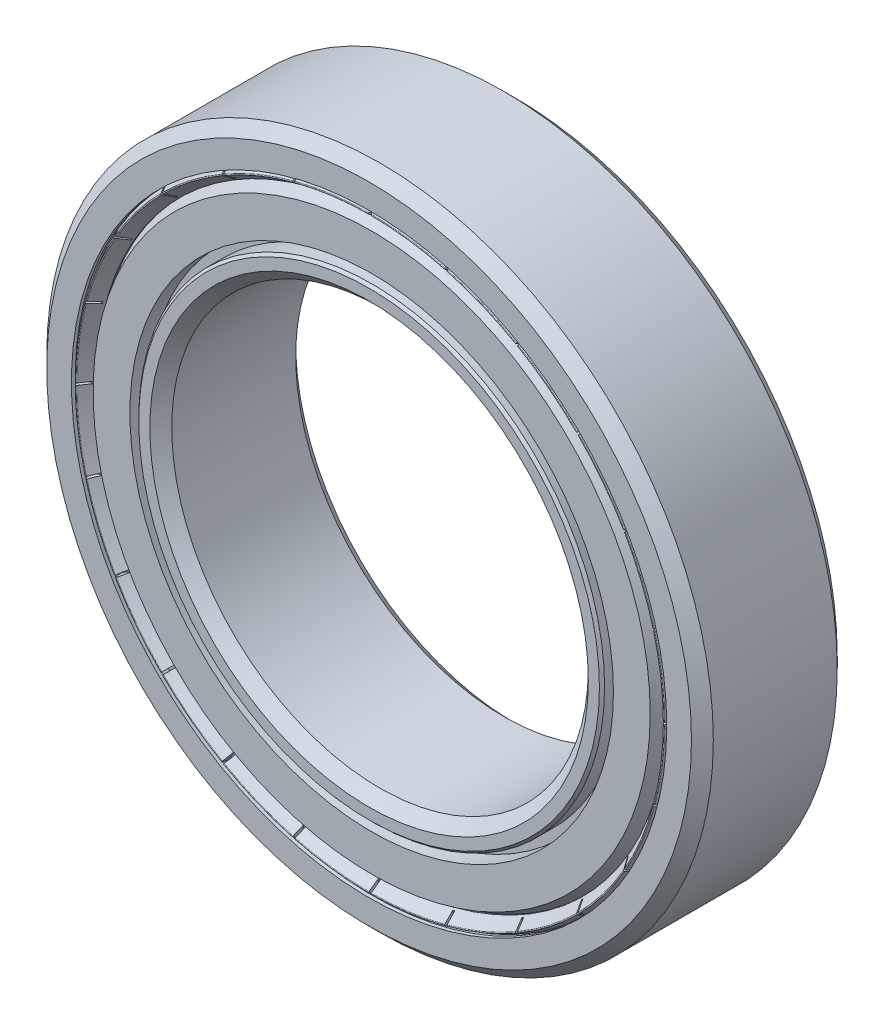
from build123d import *

# Parameters (mm, degrees)
CIRPATTERN1_COUNT  = 12
FILLET1_R          = 0.035
CUT_EXTRUDE1_START = 2.995758
CUT_EXTRUDE1_DEPTH = 20.900748284
CIRPATTERN2_COUNT  = 24


with BuildPart() as part:
    # Sketch3 → Revolve1 (revolve)
    with BuildSketch(Plane(origin=(0, 0, 0), x_dir=(0, 0, -1), z_dir=(1, 0, 0)), mode=Mode.PRIVATE) as revolve1_sk:
        with BuildLine():
            Line((2.975, 16), (-2.975, 16))
            Line((-2.975, 16), (-3.5, 15.475))
            Line((-3.5, 15.475), (-3.5, 14.289819322))
            Line((-3.5, 14.289819322), (-3.325, 14.289819322))
            Line((-3.325, 14.289819322), (-3.325, 14.694909661))
            Line((-3.325, 14.694909661), (-3.201256313, 14.818653348))
            Line((-3.201256313, 14.818653348), (-1.05, 14.818653348))
            ThreePointArc((-1.05, 14.818653348), (0, 15.1), (1.05, 14.818653348))
            Line((1.05, 14.818653348), (3.201256313, 14.818653348))
            Line((3.201256313, 14.818653348), (3.325, 14.694909661))
            Line((3.325, 14.694909661), (3.325, 14.289819322))
            Line((3.325, 14.289819322), (3.5, 14.289819322))
            Line((3.5, 14.289819322), (3.5, 15.475))
            Line((3.5, 15.475), (2.975, 16))
        make_face()
        with BuildLine():
            Line((2.975, 10), (-2.975, 10))
            Line((-2.975, 10), (-3.5, 10.525))
            Line((-3.5, 10.525), (-3.5, 11.057602965))
            Line((-3.5, 11.057602965), (-3.376256313, 11.181346652))
            Line((-3.376256313, 11.181346652), (-1.05, 11.181346652))
            ThreePointArc((-1.05, 11.181346652), (0, 10.9), (1.05, 11.181346652))
            Line((1.05, 11.181346652), (3.376256313, 11.181346652))
            Line((3.376256313, 11.181346652), (3.5, 11.057602965))
            Line((3.5, 11.057602965), (3.5, 10.525))
            Line((3.5, 10.525), (2.975, 10))
        make_face()
    revolve(revolve1_sk.sketch.rotate(Axis((0, 0, 3.5), (0, 0, -1)), 90), axis=Axis((0, 0, 3.5), (0, 0, -1)))


with BuildPart() as body_2:
    # Sketch4 → Revolve2 (revolve)
    with BuildSketch(Plane(origin=(0, 0, 0), x_dir=(0, 0, -1), z_dir=(1, 0, 0))):
        with BuildLine():
            Line((0, 15.1), (0, 10.9))
            ThreePointArc((0, 10.9), (-2.1, 13), (0, 15.1))
        make_face()
    revolve(axis=Axis((0, 16, 0), (0, -1, 0)))


with BuildPart() as cirpattern1_1:
    # CirPattern1: pattern copy
    add(body_2.part.rotate(Axis((0, 0, 0), (0, 0, 1)), 1 * 360 / CIRPATTERN1_COUNT))


with BuildPart() as cirpattern1_2:
    # CirPattern1: pattern copy
    add(body_2.part.rotate(Axis((0, 0, 0), (0, 0, 1)), 2 * 360 / CIRPATTERN1_COUNT))


with BuildPart() as cirpattern1_3:
    # CirPattern1: pattern copy
    add(body_2.part.rotate(Axis((0, 0, 0), (0, 0, 1)), 3 * 360 / CIRPATTERN1_COUNT))


with BuildPart() as cirpattern1_4:
    # CirPattern1: pattern copy
    add(body_2.part.rotate(Axis((0, 0, 0), (0, 0, 1)), 4 * 360 / CIRPATTERN1_COUNT))


with BuildPart() as cirpattern1_5:
    # CirPattern1: pattern copy
    add(body_2.part.rotate(Axis((0, 0, 0), (0, 0, 1)), 5 * 360 / CIRPATTERN1_COUNT))


with BuildPart() as cirpattern1_6:
    # CirPattern1: pattern copy
    add(body_2.part.rotate(Axis((0, 0, 0), (0, 0, 1)), 6 * 360 / CIRPATTERN1_COUNT))


with BuildPart() as cirpattern1_7:
    # CirPattern1: pattern copy
    add(body_2.part.rotate(Axis((0, 0, 0), (0, 0, 1)), 7 * 360 / CIRPATTERN1_COUNT))


with BuildPart() as cirpattern1_8:
    # CirPattern1: pattern copy
    add(body_2.part.rotate(Axis((0, 0, 0), (0, 0, 1)), 8 * 360 / CIRPATTERN1_COUNT))


with BuildPart() as cirpattern1_9:
    # CirPattern1: pattern copy
    add(body_2.part.rotate(Axis((0, 0, 0), (0, 0, 1)), 9 * 360 / CIRPATTERN1_COUNT))


with BuildPart() as cirpattern1_10:
    # CirPattern1: pattern copy
    add(body_2.part.rotate(Axis((0, 0, 0), (0, 0, 1)), 10 * 360 / CIRPATTERN1_COUNT))


with BuildPart() as cirpattern1_11:
    # CirPattern1: pattern copy
    add(body_2.part.rotate(Axis((0, 0, 0), (0, 0, 1)), 11 * 360 / CIRPATTERN1_COUNT))


with BuildPart() as body_14:
    # Sketch5 → Revolve3 (revolve)
    with BuildSketch(Plane(origin=(0, 0, 0), x_dir=(0, 0, -1), z_dir=(1, 0, 0)), mode=Mode.PRIVATE) as revolve3_sk:
        Polygon((-2.1, 11.181346652), (-2.525418771, 11.181346652), (-2.525418771, 11.606765423), (-3.376256313, 11.606765423), (-3.376256313, 13.373169267), (-2.525418771, 13.864400551), (-2.1, 13.864400551), align=None)
        Polygon((2.525418771, 13.864400551), (2.1, 13.864400551), (2.1, 11.181346652), (2.525418771, 11.181346652), (2.525418771, 11.606765423), (3.376256313, 11.606765423), (3.376256313, 13.373169267), align=None)
    revolve(revolve3_sk.sketch.rotate(Axis((0, 0, 3.5), (0, 0, -1)), 90), axis=Axis((0, 0, 3.5), (0, 0, -1)))


with BuildPart() as body_15:
    # Sketch6 → Revolve4 (revolve)
    with BuildSketch(Plane(origin=(0, 0, 0), x_dir=(0, 0, -1), z_dir=(1, 0, 0)), mode=Mode.PRIVATE) as revolve4_sk:
        Polygon((-2.797765893, 14.289819322), (-3.19375, 14.289819322), (-3.5, 14.113005803), (-2.902765893, 13.694817979), (-2.867765893, 13.694817979), (-2.797765893, 13.707160867), align=None)
    revolve(revolve4_sk.sketch.rotate(Axis((0, 0, 3.5), (0, 0, -1)), 90), axis=Axis((0, 0, 3.5), (0, 0, -1)))

    # Fillet1
    fillet1_edges = [body_15.edges().sort_by_distance(p)[0] for p in [
        (-14.113005803, 0, 3.5),
    ]]
    fillet(fillet1_edges, radius=FILLET1_R)

    # Sketch7 → Cut-Extrude1 (cut, through all)
    with BuildSketch(Plane.XY.offset(CUT_EXTRUDE1_START)):
        Polygon((-0.05, 14.289819322), (-0.05, 14.389819322), (0.05, 14.389819322), (0.05, 14.289819322), (0.05, 13.694817979), (0.05, 13.594817979), (-0.05, 13.594817979), (-0.05, 13.694817979), align=None)
    cut_extrude1 = extrude(amount=CUT_EXTRUDE1_DEPTH, mode=Mode.SUBTRACT)

    # CirPattern2: Cut-Extrude1 ×24 about axis
    cirpattern2_axis = Axis((0, 0, 0), (0, 0, 1))
    for i in range(1, CIRPATTERN2_COUNT):
        add(cut_extrude1.rotate(cirpattern2_axis, i * 360 / CIRPATTERN2_COUNT), mode=Mode.SUBTRACT)


with BuildPart() as body_16:
    # Mirror1: mirrored copy
    add(body_15.part.mirror(Plane.XY))


solid = Compound([part.part, body_2.part, cirpattern1_1.part, cirpattern1_2.part, cirpattern1_3.part, cirpattern1_4.part, cirpattern1_5.part, cirpattern1_6.part, cirpattern1_7.part, cirpattern1_8.part, cirpattern1_9.part, cirpattern1_10.part, cirpattern1_11.part, body_14.part, body_15.part, body_16.part])
